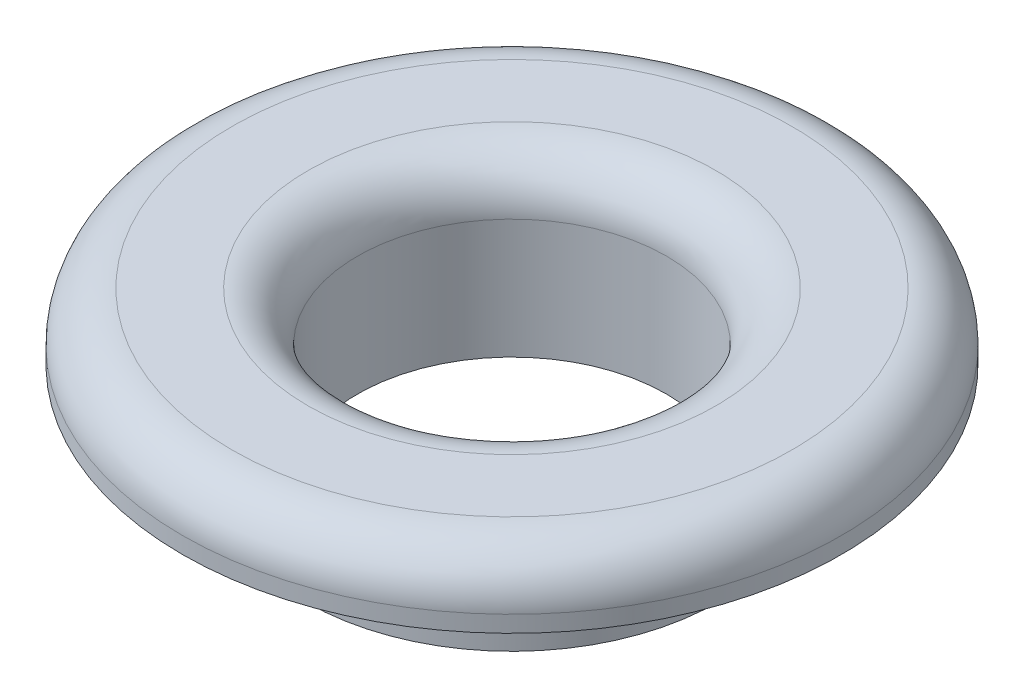
from build123d import *

# Parameters (mm, degrees)
SKETCH1_R           = 3.175
SKETCH1_R_2         = 2.38125
BOSS_EXTRUDE1_DEPTH = 1.5875
SKETCH2_R           = 5.08
SKETCH2_R_2         = 2.38125
BOSS_EXTRUDE2_DEPTH = 1.016
FILLET1_R           = 0.762


with BuildPart() as part:
    # Sketch1 → Boss-Extrude1 (new body)
    with BuildSketch(Plane(origin=(0, 0, 0), x_dir=(1, 0, 0), z_dir=(0, 1, 0))):
        Circle(SKETCH1_R)
        Circle(SKETCH1_R_2, mode=Mode.SUBTRACT)
    extrude(amount=BOSS_EXTRUDE1_DEPTH)

    # Sketch2 → Boss-Extrude2 (add)
    with BuildSketch(Plane(origin=(0, 1.5875, 0), x_dir=(1, 0, 0), z_dir=(0, 1, 0))):
        Circle(SKETCH2_R)
        Circle(SKETCH2_R_2, mode=Mode.SUBTRACT)
    extrude(amount=BOSS_EXTRUDE2_DEPTH)

    # Fillet1
    fillet1_edges = [part.edges().sort_by_distance(p)[0] for p in [
        (-5.08, 2.6035, 0),
        (-2.38125, 2.6035, 0),
    ]]
    fillet(fillet1_edges, radius=FILLET1_R)


solid = part.part
